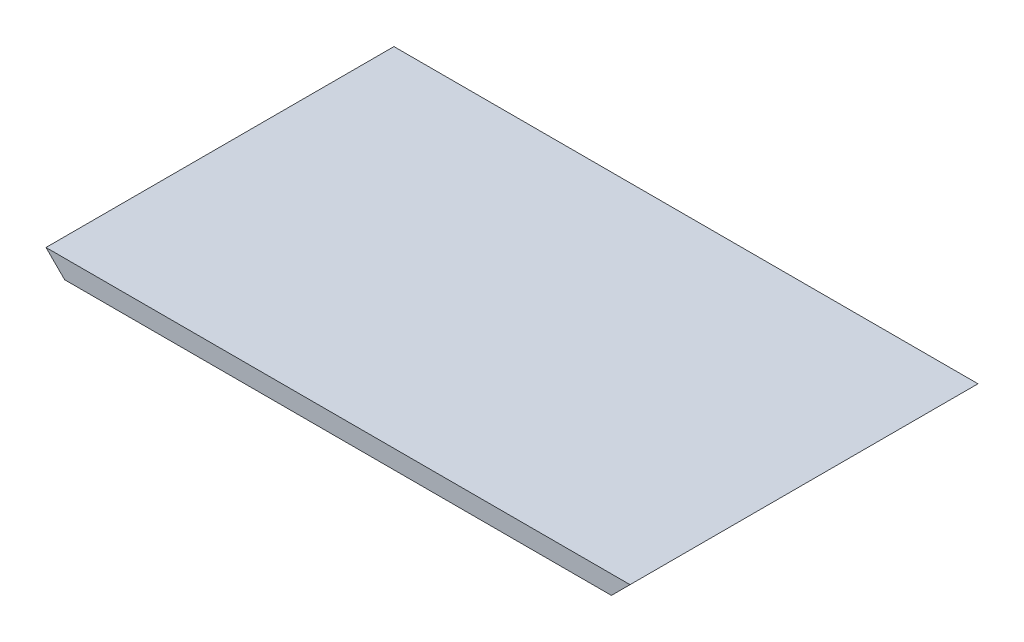
from build123d import *

# Parameters (mm, degrees)
SKETCH1_W           = 596.9
SKETCH1_H           = 355.6
BOSS_EXTRUDE1_DEPTH = 9.525
CHAMFER1_SIZE       = 19.05


with BuildPart() as part:
    # Sketch1 → Boss-Extrude1 (new, symmetric)
    with BuildSketch(Plane(origin=(0, 0, 0), x_dir=(1, 0, 0), z_dir=(0, 1, 0))):
        Rectangle(SKETCH1_W, SKETCH1_H)
    extrude(amount=BOSS_EXTRUDE1_DEPTH, both=True)

    # Chamfer1
    chamfer1_edges = [part.edges().sort_by_distance(p)[0] for p in [
        (298.45, -9.525, 0),
        (-298.45, -9.525, 0),
    ]]
    chamfer(chamfer1_edges, length=CHAMFER1_SIZE - 0.0001)  # a hair under: the kernel refuses the full size


solid = part.part
